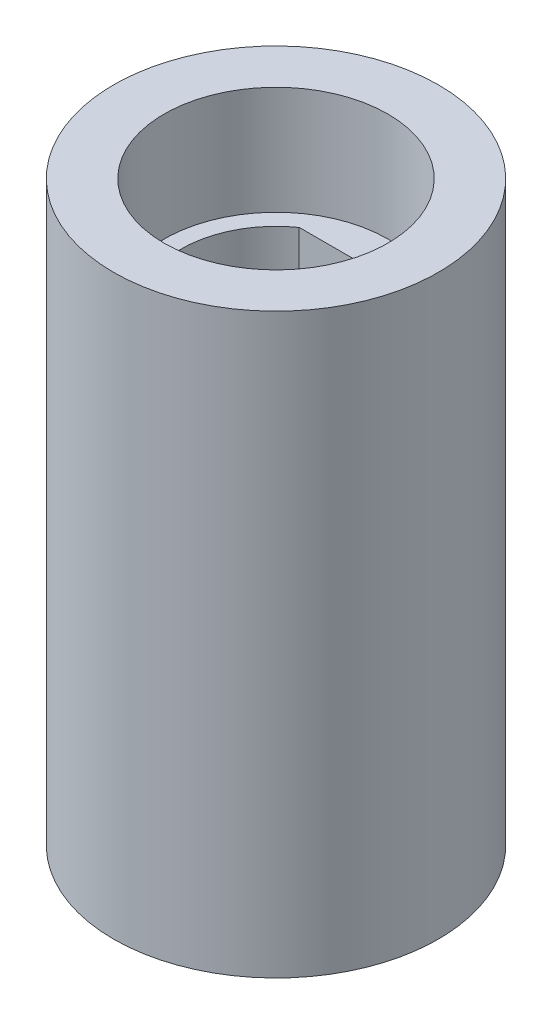
from build123d import *

# Parameters (mm, degrees)
SKETCH1_R           = 4.5
BOSS_EXTRUDE1_DEPTH = 16
SKETCH2_R           = 3.1
CUT_EXTRUDE1_DEPTH  = 3


with BuildPart() as part:
    # Sketch1 → Boss-Extrude1 (new body)
    with BuildSketch(Plane(origin=(0, 0, 0), x_dir=(1, 0, 0), z_dir=(0, 1, 0))):
        Circle(SKETCH1_R)
        with BuildLine():
            Line((1.506029548, 2.15), (-1.506029548, 2.15))
            ThreePointArc((-1.506029548, 2.15), (0, -2.625), (1.506029548, 2.15))
        make_face(mode=Mode.SUBTRACT)
    extrude(amount=BOSS_EXTRUDE1_DEPTH)

    # Sketch2 → Cut-Extrude1 (cut)
    with BuildSketch(Plane(origin=(0, 16, 0), x_dir=(1, 0, 0), z_dir=(0, 1, 0))):
        Circle(SKETCH2_R)
    extrude(amount=-CUT_EXTRUDE1_DEPTH, mode=Mode.SUBTRACT)


solid = part.part
